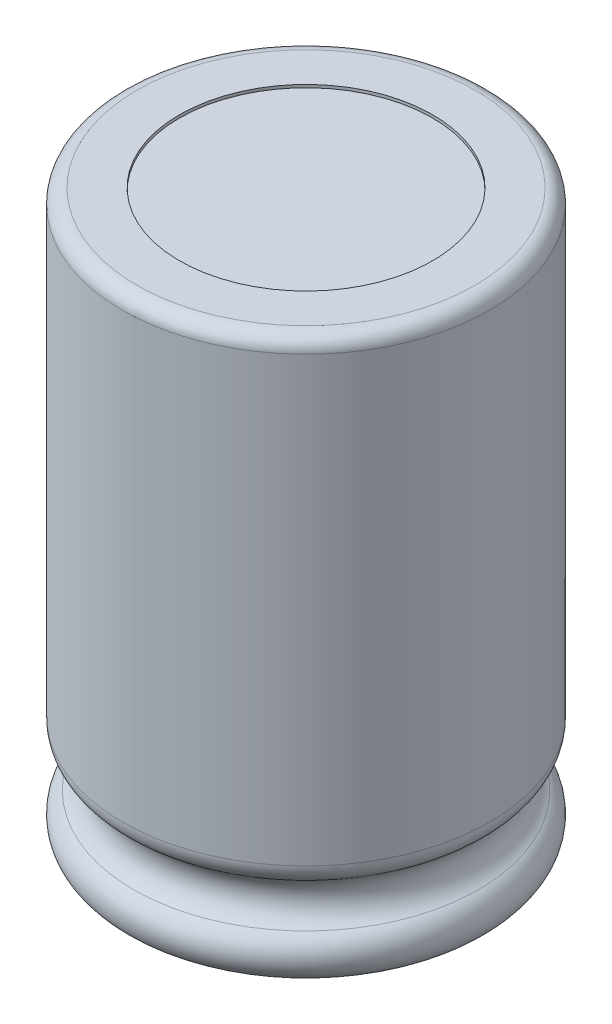
from build123d import *

# Parameters (mm, degrees)
SKETCH4_R              = 5
CUT_EXTRUDE1_DEPTH     = 0.4
BOSS_EXTRUDE1_DEPTH    = 0.8
CUT_EXTRUDE2_START     = -0.4
CUT_EXTRUDE2_DEPTH     = 0.4
SKETCH8_R              = 1.005
CUT_EXTRUDE3_DEPTH     = 1
SKETCH9_R              = 1
BOSS_EXTRUDE2_DEPTH    = 1
CHAMFER1_SIZE          = 0.7
SKETCH10_R             = 0.3
BOSS_EXTRUDE3_DEPTH    = 2.8
BOSS_EXTRUDE4_START    = 15
SKETCH11_R             = 6.35
BOSS_EXTRUDE4_DEPTH    = 15
FILLET1_R              = 0.5
SKETCH12_R             = 4.38
CUT_EXTRUDE4_DEPTH     = 0.1
SPLIT1_SURFACE_1_BACK  = 29.4
SPLIT1_SURFACE_1_DEPTH = 58.8
SPLIT1_SURFACE_2_BACK  = 29.4
SPLIT1_SURFACE_2_DEPTH = 58.8


with BuildPart() as part:
    # Sketch3 → Revolve1 (revolve)
    with BuildSketch(Plane.XY, mode=Mode.PRIVATE) as revolve1_sk:
        with BuildLine():
            Line((0, 0.4), (5.5127417, 0.4))
            ThreePointArc((5.5127417, 0.4), (6.316244242, 1.001917854), (5.964446142, 1.942215432))
            ThreePointArc((5.964446142, 1.942215432), (5.55, 2.7), (5.964446142, 3.457784568))
            ThreePointArc((5.964446142, 3.457784568), (6.247314622, 3.760990429), (6.35, 4.1627417))
            Line((6.35, 4.1627417), (6.35, 5))
            Line((6.35, 5), (0, 5))
            Line((0, 5), (0, 0.4))
        make_face()
    revolve(revolve1_sk.sketch.rotate(Axis((0, 5, 0), (0, -1, 0)), 180), axis=Axis((0, 5, 0), (0, -1, 0)))

    # Sketch4 → Cut-Extrude1 (cut)
    with BuildSketch(Plane.XZ.offset(-0.4)):
        Circle(SKETCH4_R)
    extrude(amount=-CUT_EXTRUDE1_DEPTH, mode=Mode.SUBTRACT)

    # Sketch5 → Boss-Extrude1 (add)
    with BuildSketch(Plane.XZ.offset(-0.8)):
        with BuildLine():
            Line((-3.286335345, -1.4), (-2.5, -1.4))
            ThreePointArc((-2.5, -1.4), (-1.1, 0), (-2.5, 1.4))
            Line((-2.5, 1.4), (-3.286335345, 1.4))
            ThreePointArc((-3.286335345, 1.4), (-3.542608004, 1.544037427), (-3.552794968, 1.837837838))
            ThreePointArc((-3.552794968, 1.837837838), (0, 4), (3.552794968, 1.837837838))
            ThreePointArc((3.552794968, 1.837837838), (3.542608004, 1.544037427), (3.286335345, 1.4))
            Line((3.286335345, 1.4), (2.5, 1.4))
            ThreePointArc((2.5, 1.4), (1.1, 0), (2.5, -1.4))
            Line((2.5, -1.4), (3.286335345, -1.4))
            ThreePointArc((3.286335345, -1.4), (3.542608004, -1.544037427), (3.552794968, -1.837837838))
            ThreePointArc((3.552794968, -1.837837838), (0, -4), (-3.552794968, -1.837837838))
            ThreePointArc((-3.552794968, -1.837837838), (-3.542608004, -1.544037427), (-3.286335345, -1.4))
        make_face()
    extrude(amount=BOSS_EXTRUDE1_DEPTH)

    # Sketch7 → Cut-Extrude2 (cut)
    with BuildSketch(Plane.XZ.offset(CUT_EXTRUDE2_START)):
        with BuildLine():
            Line((2.5, 1.4), (-2.5, 1.4))
            ThreePointArc((-2.5, 1.4), (-1.1, 0), (-2.5, -1.4))
            Line((-2.5, -1.4), (2.5, -1.4))
            ThreePointArc((2.5, -1.4), (1.1, 0), (2.5, 1.4))
        make_face()
    extrude(amount=CUT_EXTRUDE2_DEPTH, mode=Mode.SUBTRACT)

    # Sketch8 → Cut-Extrude3 (cut)
    with BuildSketch(Plane.XZ.offset(-0.8)):
        with Locations((-2.5, 0)):
            Circle(SKETCH8_R)
        with Locations((2.5, 0)):
            Circle(SKETCH8_R)
    extrude(amount=-CUT_EXTRUDE3_DEPTH, mode=Mode.SUBTRACT)

    # Sketch9 → Boss-Extrude2 (add)
    with BuildSketch(Plane.XZ.offset(-1.8)):
        with Locations((-2.5, 0)):
            Circle(SKETCH9_R)
        with Locations((2.5, 0)):
            Circle(SKETCH9_R)
    extrude(amount=BOSS_EXTRUDE2_DEPTH)

    # Chamfer1
    chamfer1_edges = [part.edges().sort_by_distance(p)[0] for p in [
        (-3.5, 0.8, 0),
        (1.5, 0.8, 0),
    ]]
    chamfer(chamfer1_edges, length=CHAMFER1_SIZE)

    # Sketch10 → Boss-Extrude3 (add)
    with BuildSketch(Plane.XZ.offset(-0.8)):
        with Locations(Location((-2.5, 0, 0), (0, 0, 180))):
            Circle(SKETCH10_R)
        with Locations(Location((2.5, 0, 0), (0, 0, 180))):
            Circle(SKETCH10_R)
    extrude(amount=BOSS_EXTRUDE3_DEPTH)

    # Sketch11 → Boss-Extrude4 (add)
    with BuildSketch(Plane(origin=(0, 5, 0), x_dir=(1, 0, 0), z_dir=(0, 1, 0)).offset(BOSS_EXTRUDE4_START)):
        with Locations(Location((0, 0, 0), (0, 0, 180))):
            Circle(SKETCH11_R)
    extrude(amount=-BOSS_EXTRUDE4_DEPTH)

    # Fillet1
    fillet1_edges = [part.edges().sort_by_distance(p)[0] for p in [
        (6.35, 20, 0),
    ]]
    fillet(fillet1_edges, radius=FILLET1_R)

    # Sketch12 → Cut-Extrude4 (cut)
    with BuildSketch(Plane(origin=(0, 20, 0), x_dir=(1, 0, 0), z_dir=(0, 1, 0))):
        with Locations(Location((0, 0, 0), (0, 0, 180))):
            Circle(SKETCH12_R)
    extrude(amount=-CUT_EXTRUDE4_DEPTH, mode=Mode.SUBTRACT)


with BuildPart() as body_2:
    # Split1: the piece behind the surface
    add(part.part)
    # Split1 surface: a surface, the sketch's curves swept straight by 58.8 mm
    with BuildLine(Plane(origin=(10, 0, 0), x_dir=(0, 0, -1), z_dir=(1, 0, 0)).offset(-SPLIT1_SURFACE_1_BACK), mode=Mode.PRIVATE) as split1_surface_1_path:
        Line((-1.9, 0), (1.9, 0))
        Line((1.9, 0), (1.9, 20))
        Line((1.9, 20), (-1.9, 20))
        Line((-1.9, 20), (-1.9, 0))
    split1_surface_1 = Shell.extrude(split1_surface_1_path.wire(), (1 * SPLIT1_SURFACE_1_DEPTH, 0 * SPLIT1_SURFACE_1_DEPTH, 0 * SPLIT1_SURFACE_1_DEPTH))
    split(bisect_by=split1_surface_1, keep=Keep.BOTTOM)


with BuildPart() as part_1:
    add(part.part)

    # Split1: split by a surface, the side it looks to stays
    # Split1 surface: a surface, the sketch's curves swept straight by 58.8 mm
    with BuildLine(Plane(origin=(10, 0, 0), x_dir=(0, 0, -1), z_dir=(1, 0, 0)).offset(-SPLIT1_SURFACE_2_BACK), mode=Mode.PRIVATE) as split1_surface_2_path:
        Line((-1.9, 0), (1.9, 0))
        Line((1.9, 0), (1.9, 20))
        Line((1.9, 20), (-1.9, 20))
        Line((-1.9, 20), (-1.9, 0))
    split1_surface_2 = Shell.extrude(split1_surface_2_path.wire(), (1 * SPLIT1_SURFACE_2_DEPTH, 0 * SPLIT1_SURFACE_2_DEPTH, 0 * SPLIT1_SURFACE_2_DEPTH))
    split(bisect_by=split1_surface_2, keep=Keep.TOP)

    # Combine1: read off the stored shape, not the designer's step
    # Combine1: union body 2
    add(body_2.part)


solid = part_1.part
